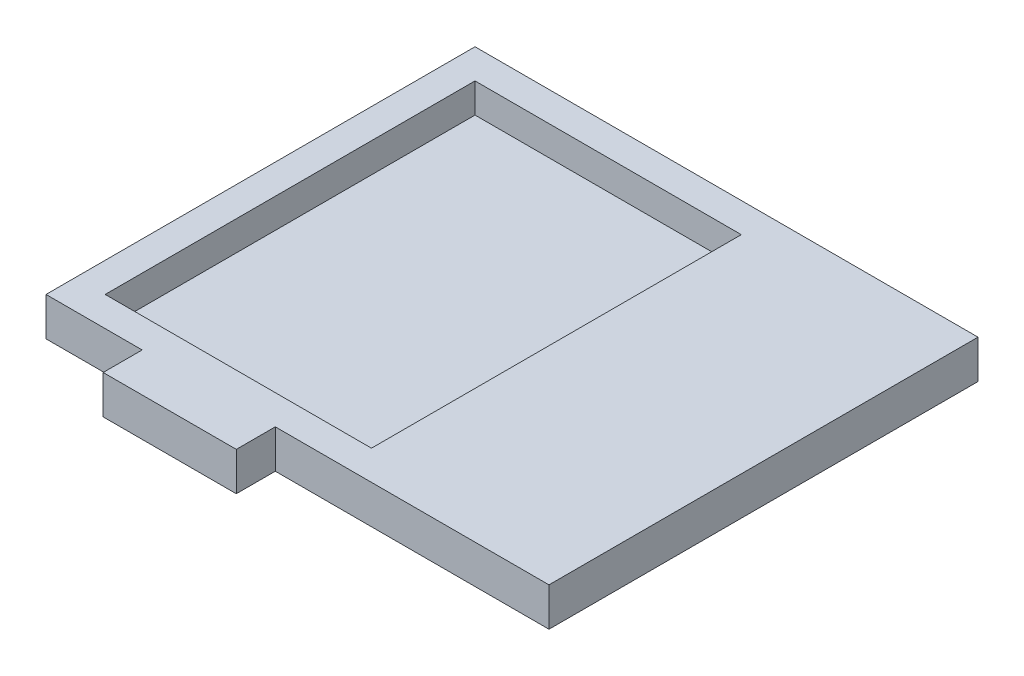
from build123d import *

# Parameters (mm, degrees)
BOSS_EXTRUDE1_DEPTH = 3
BOSS_EXTRUDE2_DEPTH = 10


with BuildPart() as part:
    # Sketch1 → Boss-Extrude1 (new body)
    with BuildSketch(Plane(origin=(0, 0, 0), x_dir=(1, 0, 0), z_dir=(0, 1, 0))):
        Polygon((-10, 135), (-10, -10), (22.5, -10), (22.5, -23.183655632), (67.5, -23.183655632), (67.5, -10), (160, -10), (160, 135), align=None)
    extrude(amount=-BOSS_EXTRUDE1_DEPTH)

    # Sketch1<3> → Boss-Extrude2 (add)
    with BuildSketch(Plane(origin=(0, 0, 0), x_dir=(1, 0, 0), z_dir=(0, 1, 0))):
        Polygon((-10, -10), (22.5, -10), (22.5, -23.183655632), (67.5, -23.183655632), (67.5, -10), (160, -10), (160, 135), (-10, 135), align=None)
        Polygon((90, 0), (45, 0), (0, 0), (0, 125), (90, 125), align=None, mode=Mode.SUBTRACT)
    extrude(amount=BOSS_EXTRUDE2_DEPTH)


solid = part.part
